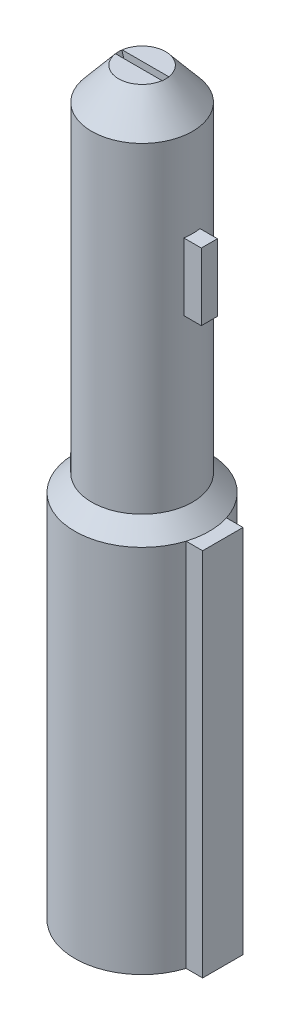
from build123d import *

# Parameters (mm, degrees)
SKETCH1_R           = 10
BOSS_EXTRUDE1_DEPTH = 60
SKETCH2_R           = 7.5
BOSS_EXTRUDE2_DEPTH = 30
CHAMFER2_SIZE       = 5
SKETCH3_R           = 7.5
BOSS_EXTRUDE3_DEPTH = 20
CHAMFER3_SIZE       = 4
CHAMFER3_SIZE2      = 4.76701437
SKETCH5_W           = 6
SKETCH5_H           = 55
BOSS_EXTRUDE5_DEPTH = 12
SKETCH6_W           = 2.4
SKETCH6_H           = 10
BOSS_EXTRUDE6_DEPTH = 10
SKETCH13_W          = 6
SKETCH13_H          = 1
CUT_EXTRUDE2_DEPTH  = 10
SKETCH14_W          = 6
SKETCH14_H          = 1
CUT_EXTRUDE3_DEPTH  = 5
CHAMFER22_SIZE      = 0.5
CHAMFER22_SIZE_2    = 1.866025404
SKETCH17_W          = 1
SKETCH17_H          = 2.5
BOSS_EXTRUDE7_DEPTH = 0.5
FILLET1_R           = 1
FILLET2_R           = 5


with BuildPart() as part:
    # Sketch1 → Boss-Extrude1 (new body)
    with BuildSketch(Plane(origin=(0, 0, 0), x_dir=(1, 0, 0), z_dir=(0, 1, 0))):
        with Locations(Location((0, 0, 0), (0, 0, 90))):
            Circle(SKETCH1_R)
    extrude(amount=BOSS_EXTRUDE1_DEPTH)

    # Sketch2 → Boss-Extrude2 (add)
    with BuildSketch(Plane(origin=(0, 60, 0), x_dir=(1, 0, 0), z_dir=(0, 1, 0))):
        with Locations(Location((0, 0, 0), (0, 0, 270))):
            Circle(SKETCH2_R)
    extrude(amount=BOSS_EXTRUDE2_DEPTH)

    # Chamfer2
    # the kernel refuses this chamfer: 5 mm, written as the material it takes off along each edge
    with BuildSketch(Plane(origin=(0, 60, 0), x_dir=(0, 0, -1), z_dir=(1, 0, 0))) as chamfer2_piece_1_section:
        Polygon((10, -CHAMFER2_SIZE), (10 - CHAMFER2_SIZE, 0), (10, 0), align=None)
    chamfer2_piece_1 = revolve(axis=Axis((0, 60, 0), (0, 1, 0)), mode=Mode.PRIVATE)
    chamfer2_piece_1 = chamfer2_piece_1 - Plane(origin=(0, 56.238108378, 0), x_dir=(0, 0, 1), z_dir=(0, -1, 0)) * Cylinder(7.5, 40, mode=Mode.PRIVATE)
    add(chamfer2_piece_1, mode=Mode.SUBTRACT)

    # Sketch3 → Boss-Extrude3 (add)
    with BuildSketch(Plane(origin=(0, 90, 0), x_dir=(1, 0, 0), z_dir=(0, 1, 0))):
        with Locations(Location((0, 0, 0), (0, 0, 90))):
            Circle(SKETCH3_R)
    extrude(amount=BOSS_EXTRUDE3_DEPTH)

    # Chamfer3
    chamfer3_edges = [part.edges().sort_by_distance(p)[0] for p in [
        (0, 110, 7.5),
    ]]
    chamfer3_side = [part.faces().sort_by_distance(p)[0] for p in [
        (0, 110, 0),
    ]]
    chamfer(chamfer3_edges, length=CHAMFER3_SIZE, length2=CHAMFER3_SIZE2, reference=chamfer3_side[0])

    # Sketch5 → Boss-Extrude5 (add)
    with BuildSketch(Plane(origin=(0, 0, 0), x_dir=(0, 0, -1), z_dir=(1, 0, 0))):
        with Locations((0, 27.5)):
            Rectangle(SKETCH5_W, SKETCH5_H)
    extrude(amount=BOSS_EXTRUDE5_DEPTH)

    # Sketch6 → Boss-Extrude6 (add)
    with BuildSketch(Plane(origin=(0, 0, 0), x_dir=(0, 0, -1), z_dir=(1, 0, 0))):
        with Locations((0, 87.067071975)):
            Rectangle(SKETCH6_W, SKETCH6_H)
    extrude(amount=BOSS_EXTRUDE6_DEPTH)

    # Sketch13 → Cut-Extrude2 (cut)
    with BuildSketch(Plane(origin=(0, 110, 0), x_dir=(1, 0, 0), z_dir=(0, 1, 0))):
        Rectangle(SKETCH13_W, SKETCH13_H)
    extrude(amount=-CUT_EXTRUDE2_DEPTH, mode=Mode.SUBTRACT)

    # Sketch14 → Cut-Extrude3 (cut)
    with BuildSketch(Plane(origin=(0, 100, 0), x_dir=(1, 0, 0), z_dir=(0, 1, 0))):
        Rectangle(SKETCH14_W, SKETCH14_H)
    extrude(amount=-CUT_EXTRUDE3_DEPTH, mode=Mode.SUBTRACT)

    # Chamfer22
    # the kernel refuses this chamfer: 1.866025404, 0.5 mm, written as the material it takes off along each edge
    with BuildSketch(Plane(origin=(3, 110, 0.5), x_dir=(0.9905000388259552, 0.13751244702128432, 0), z_dir=(0, 0, -1)), Plane(origin=(-3, 110, -0.5), x_dir=(-0.9905000388259552, 0.13751244702128432, 0), z_dir=(0, 0, 1))) as chamfer22_piece_1:
        Polygon((CHAMFER22_SIZE * 0.990500038826, CHAMFER22_SIZE * 0.137512447021), (-CHAMFER22_SIZE_2 * 0.137512447005, CHAMFER22_SIZE_2 * 0.990500038712), (0, 0), align=None)
    extrude(amount=1, mode=Mode.SUBTRACT)

    # Sketch17 → Boss-Extrude7 (add)
    with BuildSketch(Plane(origin=(0, 0, 0.5), x_dir=(-1, 0, 0), z_dir=(0, 0, -1))):
        with Locations((0, 101.254046964)):
            Rectangle(SKETCH17_W, SKETCH17_H)
    extrude(amount=BOSS_EXTRUDE7_DEPTH)

    # Fillet1
    # the kernel refuses this fillet: 1 mm, written as the material it takes off along each edge
    with BuildSketch(Plane(origin=(-2.665063509, 102.504046964, 0), x_dir=(0, 0, 1), z_dir=(1, 0, 0))) as fillet1_piece_1:
        with BuildLine():
            CenterArc((1, 0.866025404), FILLET1_R, 180, 60)
            Line((0, 0.866025404), (-0.02, 0.866025404))
            Line((-0.02, 0.866025404), (-0.02, 0))
            Line((-0.02, 0), (0, -0.02))
            ThreePointArc((0, -0.02), (0.25, -0.02), (0.49, -0.017320508))
            Line((0.49, -0.017320508), (0.5, 0))
        make_face()
    extrude(amount=5.330127019, mode=Mode.SUBTRACT)

    # Fillet2
    fillet2_edges = [part.edges().sort_by_distance(p)[0] for p in [
        (3, 108.133974596, 0),
        (-3, 108.133974596, 0),
    ]]
    fillet(fillet2_edges, radius=FILLET2_R)


solid = part.part
